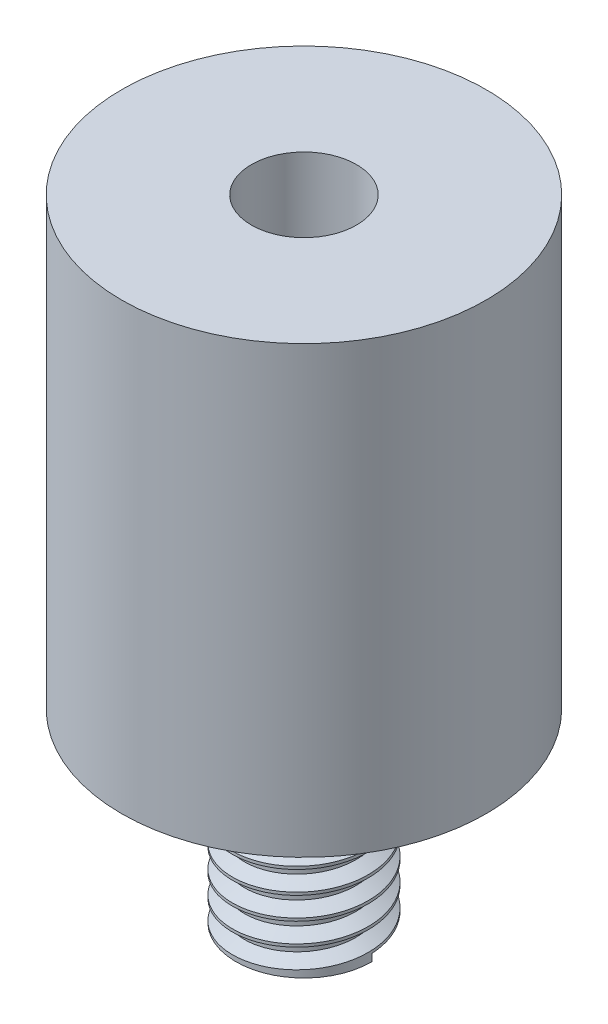
from build123d import *

# Parameters (mm, degrees)
THREAD_1_PITCH = 1.814285714


with BuildPart() as part:
    # Sketch 1 → Повернуть1 (revolve)
    with BuildSketch(Plane.XY, mode=Mode.PRIVATE) as revolve_1_sk:
        Polygon((0, 0), (-5.5, 0), (-5.5, 15), (-14.75, 15), (-14.75, 51), (-4.25, 51), (-4.25, 26), (0, 26), align=None)
    revolve(revolve_1_sk.sketch.rotate(Axis((0, 0, 0), (0, -1, 0)), 270), axis=Axis((0, 0, 0), (0, -1, 0)))

    # Резьба1: the profile of Sketch 1 2 profile screwed along a right-hand helix of 8.818898 turns, 10 arcs to a turn; built about Z, then put on its axis
    thread_1_z = Axis((0, 0, 0), (0, 0, 1))
    thread_1_corners = [(5.5003, 0, -0.000173205), (5.5003, 0, 1.5876732), (4.517989055, 0, 1.020535712), (4.517989055, 0, 0.566964283)]
    with BuildLine(mode=Mode.PRIVATE) as thread_1_profile:
        Line(thread_1_corners[0], thread_1_corners[1])
        Line(thread_1_corners[1], thread_1_corners[2])
        Line(thread_1_corners[2], thread_1_corners[3])
        Line(thread_1_corners[3], thread_1_corners[0])
    thread_1_cap = Face(thread_1_profile.wire())
    thread_1_turn_angles = [0, 18, 36, 54, 72, 90, 108, 126, 144, 162, 180, 198, 216, 234, 252, 270, 288, 306, 324, 342, 360]
    thread_1_turn_weights = [1, 0.9510565162951535, 1, 0.9510565162951535, 1, 0.9510565162951535, 1, 0.9510565162951535, 1, 0.9510565162951535, 1, 0.9510565162951535, 1, 0.9510565162951535, 1, 0.9510565162951535, 1, 0.9510565162951535, 1, 0.9510565162951535, 1]
    thread_1_turn_rails = [Edge.make_bspline([Vector(p[0], p[1], 0).rotate(thread_1_z, thread_1_turn_angles[k]) / thread_1_turn_weights[k] + Vector(0, 0, p[2] + THREAD_1_PITCH * thread_1_turn_angles[k] / 360) for k in range(21)], [0, 0, 0, 1, 1, 2, 2, 3, 3, 4, 4, 5, 5, 6, 6, 7, 7, 8, 8, 9, 9, 10, 10, 10], 2, thread_1_turn_weights) for p in thread_1_corners]
    thread_1_turn_sides = [Face.make_surface_from_curves(thread_1_turn_rails[p[0]], thread_1_turn_rails[p[1]]) for p in [(0, 1), (1, 2), (2, 3), (3, 0)]]
    thread_1_last_angles = [2880, 2898, 2916, 2934, 2952, 2970, 2988, 3006, 3024, 3042, 3060, 3078, 3096, 3114, 3132, 3150, 3168, 3171.401574803, 3174.803149606]
    thread_1_last_weights = [1, 0.9510565162951535, 1, 0.9510565162951535, 1, 0.9510565162951535, 1, 0.9510565162951535, 1, 0.9510565162951535, 1, 0.9510565162951535, 1, 0.9510565162951535, 1, 0.9510565162951535, 1, 0.9982381974813711, 1]
    thread_1_last_rails = [Edge.make_bspline([Vector(p[0], p[1], 0).rotate(thread_1_z, thread_1_last_angles[k]) / thread_1_last_weights[k] + Vector(0, 0, p[2] + THREAD_1_PITCH * thread_1_last_angles[k] / 360) for k in range(19)], [0, 0, 0, 1, 1, 2, 2, 3, 3, 4, 4, 5, 5, 6, 6, 7, 7, 8, 8, 9, 9, 9], 2, thread_1_last_weights) for p in thread_1_corners]
    thread_1_last_sides = [Face.make_surface_from_curves(thread_1_last_rails[p[0]], thread_1_last_rails[p[1]]) for p in [(0, 1), (1, 2), (2, 3), (3, 0)]]
    thread_1 = Plane(origin=(0, -1, 0), x_dir=(1, 0, 0), z_dir=(0, 1, 0)) * Solid(Shell([*[p.moved(Location((0, 0, THREAD_1_PITCH * i))) for i in range(8) for p in thread_1_turn_sides], *thread_1_last_sides, thread_1_cap, thread_1_cap.rotate(thread_1_z, 3174.803149606).moved(Location((0, 0, THREAD_1_PITCH * 3174.803149606 / 360)))]))
    add(thread_1, mode=Mode.SUBTRACT)


solid = part.part
